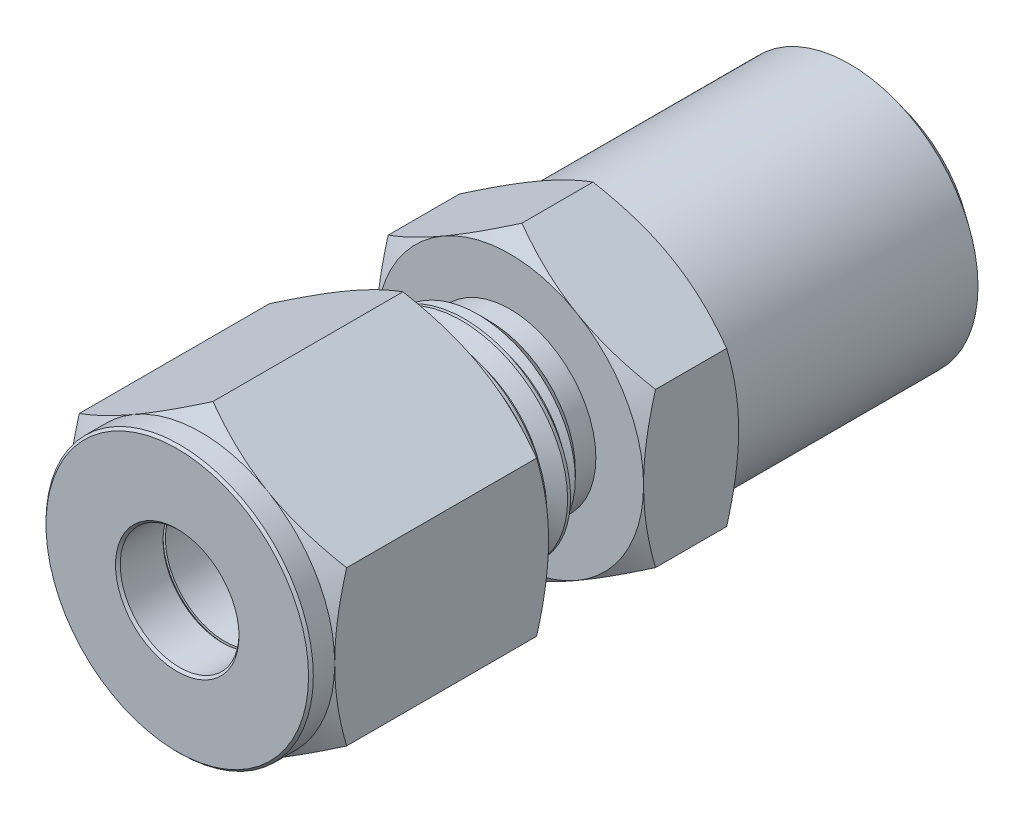
from build123d import *

# Parameters (mm, degrees)
BOSS_EXTRUDE1_DEPTH = 12.7
CHAMFER1_SIZE       = 0.127
SKETCH4_W           = 10.414
SKETCH4_H           = 5.55625
CUT_SWEEP1_PITCH    = 1.27
BOSS_EXTRUDE2_DEPTH = 5.08
SKETCH11_W          = 14.224
SKETCH11_H          = 6.858


with BuildPart() as part:
    # Sketch2 → Boss-Extrude1 (new body)
    with BuildSketch(Plane.XY):
        Polygon((0, 8.248891971), (-7.14375, 4.124445986), (-7.14375, -4.124445986), (0, -8.248891971), (7.14375, -4.124445986), (7.14375, 4.124445986), align=None)
    extrude(amount=-BOSS_EXTRUDE1_DEPTH)

    # Sketch3 → Cut-Revolve1 (revolve, cut)
    with BuildSketch(Plane(origin=(0, 0, 0), x_dir=(0, 0, -1), z_dir=(1, 0, 0)), mode=Mode.PRIVATE) as cut_revolve1_sk:
        Polygon((0, 8.248891971), (0, 7.14375), (1.27, 7.14375), (1.908054014, 8.248891971), (12.061945986, 8.248891971), (12.7, 7.14375), (12.7, 8.248891971), (12.7, 9.354033942), (0, 9.354033942), align=None)
        Polygon((0, 3.175), (0, 0), (12.7, 0), (12.7, 5.55625), (5.08, 5.55625), (5.08, 4.92125), (2.54, 4.92125), (2.54, 4.28625), (2.54, 3.175), align=None)
    revolve(cut_revolve1_sk.sketch.rotate(Axis((0, 0, 0), (0, 0, -1)), 90), axis=Axis((0, 0, 0), (0, 0, -1)), mode=Mode.SUBTRACT)

    # Chamfer1
    chamfer1_edges = [part.edges().sort_by_distance(p)[0] for p in [
        (-7.14375, 0, 0),
        (-3.175, 0, -2.54),
        (-3.175, 0, 0),
    ]]
    chamfer(chamfer1_edges, length=CHAMFER1_SIZE)


with BuildPart() as body_2:
    # Sketch4 → Revolve1 (revolve)
    with BuildSketch(Plane(origin=(0, 0, 0), x_dir=(0, 0, -1), z_dir=(1, 0, 0)), mode=Mode.PRIVATE) as revolve1_sk:
        with Locations((12.573, 2.778125)):
            Rectangle(SKETCH4_W, SKETCH4_H)
    revolve(revolve1_sk.sketch.rotate(Axis((0, 0, -17.78), (0, 0, 1)), 90), axis=Axis((0, 0, -17.78), (0, 0, 1)))

    # Cut-Sweep1: the profile of Sketch6 screwed along a right-hand helix of 9.2 turns, 8 arcs to a turn; built about Z, then put on its axis
    cut_sweep1_z = Axis((0, 0, 0), (0, 0, 1))
    cut_sweep1_corners = [(4.731360803, 0, -0.635), (5.624990766, 0, -1.1509375), (5.624990766, 0, 0.0396875), (4.731360803, 0, -0.47625)]
    with BuildLine(mode=Mode.PRIVATE) as cut_sweep1_profile:
        Line(cut_sweep1_corners[0], cut_sweep1_corners[1])
        Line(cut_sweep1_corners[1], cut_sweep1_corners[2])
        Line(cut_sweep1_corners[2], cut_sweep1_corners[3])
        Line(cut_sweep1_corners[3], cut_sweep1_corners[0])
    cut_sweep1_cap = Face(cut_sweep1_profile.wire())
    cut_sweep1_turn_angles = [0, 22.5, 45, 67.5, 90, 112.5, 135, 157.5, 180, 202.5, 225, 247.5, 270, 292.5, 315, 337.5, 360]
    cut_sweep1_turn_weights = [1, 0.9238795325112867, 1, 0.9238795325112867, 1, 0.9238795325112867, 1, 0.9238795325112867, 1, 0.9238795325112867, 1, 0.9238795325112867, 1, 0.9238795325112867, 1, 0.9238795325112867, 1]
    cut_sweep1_turn_rails = [Edge.make_bspline([Vector(p[0], p[1], 0).rotate(cut_sweep1_z, cut_sweep1_turn_angles[k]) / cut_sweep1_turn_weights[k] + Vector(0, 0, p[2] + CUT_SWEEP1_PITCH * cut_sweep1_turn_angles[k] / 360) for k in range(17)], [0, 0, 0, 1, 1, 2, 2, 3, 3, 4, 4, 5, 5, 6, 6, 7, 7, 8, 8, 8], 2, cut_sweep1_turn_weights) for p in cut_sweep1_corners]
    cut_sweep1_turn_sides = [Face.make_surface_from_curves(cut_sweep1_turn_rails[p[0]], cut_sweep1_turn_rails[p[1]]) for p in [(0, 1), (1, 2), (2, 3), (3, 0)]]
    cut_sweep1_last_angles = [3240, 3262.5, 3285, 3298.5, 3312]
    cut_sweep1_last_weights = [1, 0.9238795325112867, 1, 0.9723699203976219, 1]
    cut_sweep1_last_rails = [Edge.make_bspline([Vector(p[0], p[1], 0).rotate(cut_sweep1_z, cut_sweep1_last_angles[k]) / cut_sweep1_last_weights[k] + Vector(0, 0, p[2] + CUT_SWEEP1_PITCH * cut_sweep1_last_angles[k] / 360) for k in range(5)], [0, 0, 0, 1, 1, 2, 2, 2], 2, cut_sweep1_last_weights) for p in cut_sweep1_corners]
    cut_sweep1_last_sides = [Face.make_surface_from_curves(cut_sweep1_last_rails[p[0]], cut_sweep1_last_rails[p[1]]) for p in [(0, 1), (1, 2), (2, 3), (3, 0)]]
    cut_sweep1 = Plane(origin=(0, 0, -7.366), x_dir=(0, 1, 0), z_dir=(0, 0, -1)) * Solid(Shell([*[p.moved(Location((0, 0, CUT_SWEEP1_PITCH * i))) for i in range(9) for p in cut_sweep1_turn_sides], *cut_sweep1_last_sides, cut_sweep1_cap, cut_sweep1_cap.rotate(cut_sweep1_z, 3312).moved(Location((0, 0, CUT_SWEEP1_PITCH * 3312 / 360)))]))
    add(cut_sweep1, mode=Mode.SUBTRACT)

    # Sketch7 → Boss-Extrude2 (add)
    with BuildSketch(Plane(origin=(0, 0, -17.78), x_dir=(-1, 0, 0), z_dir=(0, 0, -1))):
        Polygon((0, 8.248891971), (-7.14375, 4.124445986), (-7.14375, -4.124445986), (0, -8.248891971), (7.14375, -4.124445986), (7.14375, 4.124445986), align=None)
    extrude(amount=BOSS_EXTRUDE2_DEPTH)

    # Sketch8 → Cut-Revolve2 (revolve, cut)
    with BuildSketch(Plane(origin=(0, 0, 0), x_dir=(0, 0, -1), z_dir=(1, 0, 0)), mode=Mode.PRIVATE) as cut_revolve2_sk:
        Polygon((7.366, 5.693731533), (7.366, 4.59387927), (8.465852263, 5.693731533), align=None)
        Polygon((17.78, 5.693731533), (15.580295474, 5.693731533), (16.680147737, 4.59387927), (17.78, 4.59387927), align=None)
        Polygon((17.78, 7.14375), (18.418054014, 8.248891971), (22.221945986, 8.248891971), (22.86, 7.14375), (22.86, 8.248891971), (22.86, 9.354033942), (17.78, 9.354033942), (17.78, 8.248891971), align=None)
        Polygon((15.24, 2.3749), (22.86, 2.3749), (22.86, 0), (7.366, 0), (7.366, 4.044817708), (11.249837209, 3.175), (15.24, 3.175), align=None)
    revolve(cut_revolve2_sk.sketch.rotate(Axis((0, 0, 0), (0, 0, -1)), 90), axis=Axis((0, 0, 0), (0, 0, -1)), mode=Mode.SUBTRACT)

    # Sketch11 → Revolve4 (revolve)
    with BuildSketch(Plane(origin=(0, 0, 0), x_dir=(0, 0, -1), z_dir=(1, 0, 0)), mode=Mode.PRIVATE) as revolve4_sk:
        with Locations((29.972, 3.429)):
            Rectangle(SKETCH11_W, SKETCH11_H)
    revolve(revolve4_sk.sketch.rotate(Axis((0, 0, -22.86), (0, 0, -1)), 90), axis=Axis((0, 0, -22.86), (0, 0, -1)))

    # Sketch14 → Cut-Revolve4 (revolve, cut)
    with BuildSketch(Plane(origin=(0, 0, 0), x_dir=(0, 0, -1), z_dir=(1, 0, 0)), mode=Mode.PRIVATE) as cut_revolve4_sk:
        Polygon((37.084, 5.367866667), (35.940580478, 6.858), (37.084, 6.858), align=None)
        Polygon((37.084, 4.6228), (22.86, 4.6228), (20.08234153, 0), (37.084, 0), align=None)
    revolve(cut_revolve4_sk.sketch.rotate(Axis((0, 0, 0), (0, 0, -1)), 90), axis=Axis((0, 0, 0), (0, 0, -1)), mode=Mode.SUBTRACT)


with BuildPart() as body_3:
    # Sketch9 → Revolve2 (revolve)
    with BuildSketch(Plane(origin=(0, 0, 0), x_dir=(0, 0, -1), z_dir=(1, 0, 0)), mode=Mode.PRIVATE) as revolve2_sk:
        Polygon((4.445, 4.699), (4.445, 3.8608), (5.1308, 3.175), (9.3218, 3.175), (9.3218, 3.6068), align=None)
    revolve(revolve2_sk.sketch.rotate(Axis((0, 0, 0), (0, 0, -1)), 90), axis=Axis((0, 0, 0), (0, 0, -1)))


with BuildPart() as body_4:
    # Sketch10 → Revolve3 (revolve)
    with BuildSketch(Plane(origin=(0, 0, 0), x_dir=(0, 0, -1), z_dir=(1, 0, 0)), mode=Mode.PRIVATE) as revolve3_sk:
        Polygon((2.54, 4.6609), (3.556, 4.6609), (3.556, 3.8608), (4.445, 3.8608), (5.1308, 3.175), (2.54, 3.175), align=None)
    revolve(revolve3_sk.sketch.rotate(Axis((0, 0, 0), (0, 0, -1)), 90), axis=Axis((0, 0, 0), (0, 0, -1)))


solid = Compound([part.part, body_2.part, body_3.part, body_4.part])
